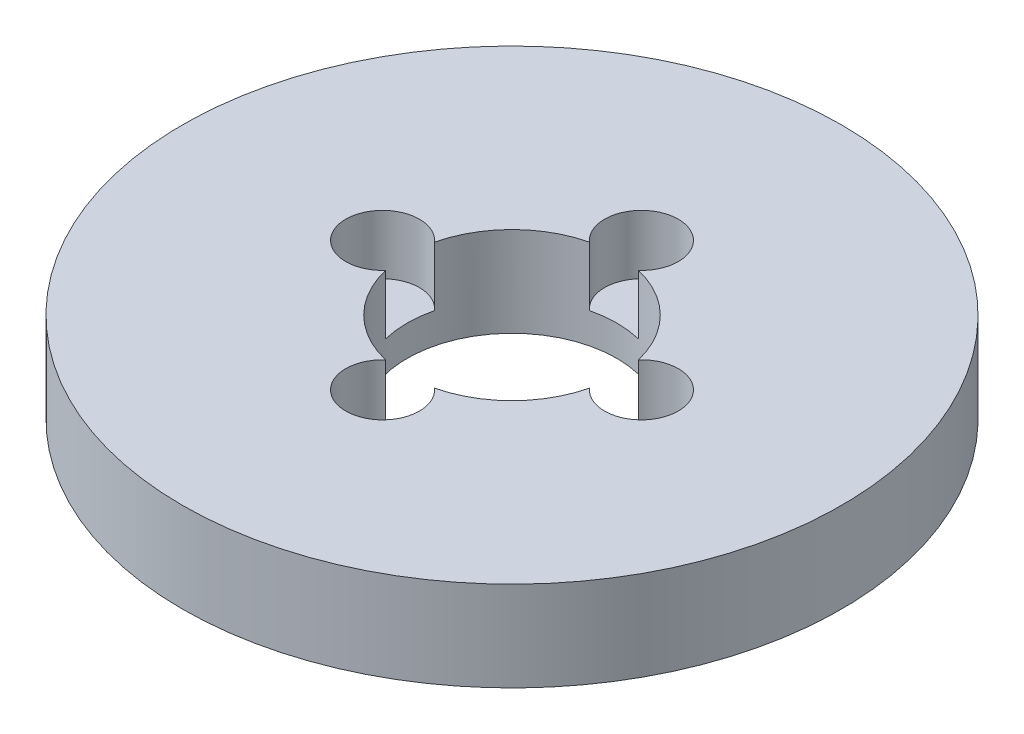
from build123d import *

# Parameters (mm, degrees)
SKETCH1_R           = 55
BOSS_EXTRUDE1_DEPTH = 15
SKETCH2_R           = 17.5
CUT_EXTRUDE1_DEPTH  = 80.214897589
SKETCH3_R           = 6.14582619
CUT_EXTRUDE2_DEPTH  = 9.893922801
CIRPATTERN1_COUNT   = 4


with BuildPart() as part:
    # Sketch1 → Boss-Extrude1 (new body)
    with BuildSketch(Plane(origin=(0, 0, 0), x_dir=(1, 0, 0), z_dir=(0, 1, 0))):
        Circle(SKETCH1_R)
    extrude(amount=BOSS_EXTRUDE1_DEPTH)

    # Sketch2 → Cut-Extrude1 (cut, through all)
    with BuildSketch(Plane(origin=(0, 0, 0), x_dir=(1, 0, 0), z_dir=(0, 1, 0))):
        Circle(SKETCH2_R)
    extrude(amount=CUT_EXTRUDE1_DEPTH, mode=Mode.SUBTRACT)

    # Sketch3 → Cut-Extrude2 (cut)
    with BuildSketch(Plane(origin=(0, 15, 0), x_dir=(1, 0, 0), z_dir=(0, 1, 0))):
        with Locations((-21.600579373, 0)):
            Circle(SKETCH3_R)
    cut_extrude2 = extrude(amount=-CUT_EXTRUDE2_DEPTH, mode=Mode.SUBTRACT)

    # CirPattern1: Cut-Extrude2 ×4 about axis
    cirpattern1_axis = Axis((0, 0, 0), (0, 1, 0))
    for i in range(1, CIRPATTERN1_COUNT):
        add(cut_extrude2.rotate(cirpattern1_axis, i * 360 / CIRPATTERN1_COUNT), mode=Mode.SUBTRACT)


solid = part.part
